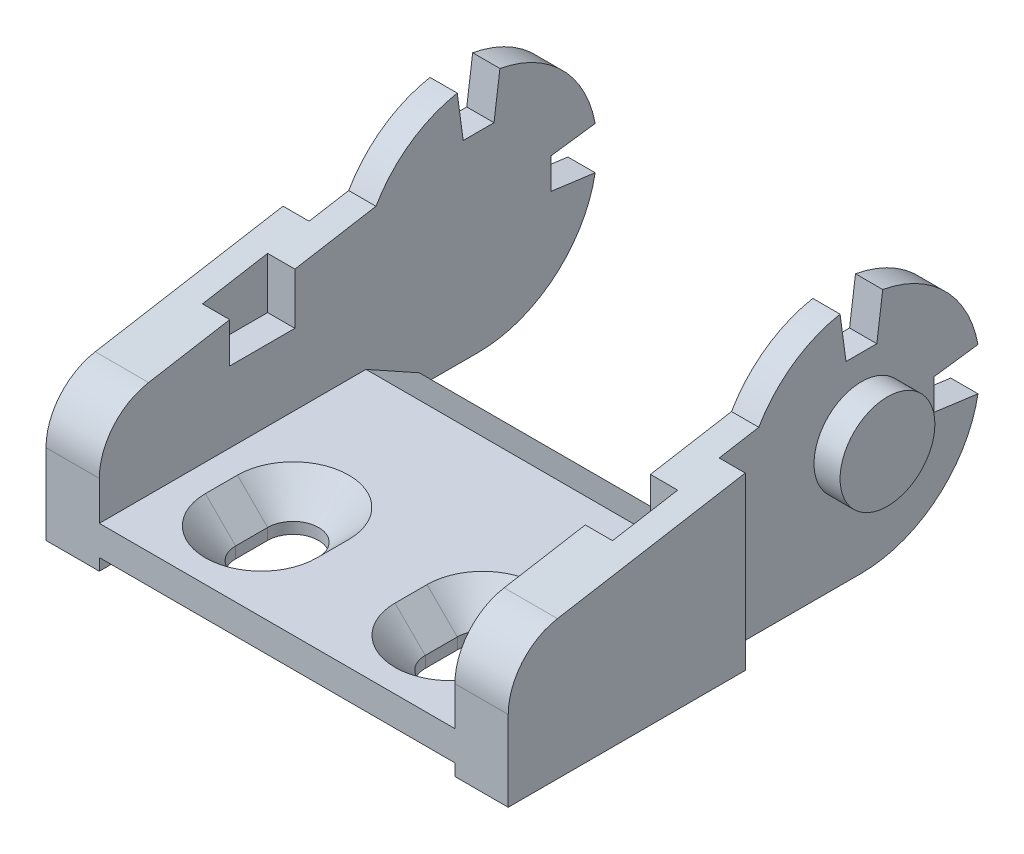
from build123d import *

# Parameters (mm, degrees)
BODY_DEPTH                                       = 32
BODY_DEPTH_BACK                                  = 15
PIVOT_START                                      = 15
PIVOT_PIN_R_SKETCH_R                             = 4
PIVOT_PIN_R_DEPTH                                = 4.25
OUTSIDE_SHAPE_CUT_OUT_DEPTH                      = 40.272286666
OUTSIDE_SHAPE_CUT_OUT_DEPTH_BACK                 = 40.272286666
OUTSIDE_SHAPE_CUT_OUT_SKETCH_W                   = 49
OUTSIDE_SHAPE_CUT_OUT_SKETCH_H                   = 22
OUTSIDE_START                                    = 17.3
OUTSIDE_SHAPE_CUT_OUT_SKETCH_R_W                 = 24
OUTSIDE_SHAPE_CUT_OUT_SKETCH_R_H                 = 24
OUTSIDE_SHAPE_CUT_OUT_SKETCH_R_R                 = 4
OUTSIDE_SHAPE_CUT_OUT_R_DEPTH                    = 22.923727913
INSIDE_START                                     = 15
INSIDE_SHAPE_CUT_OUT_DEPTH                       = 30
LIGHTENING_START                                 = 1.25
LIGHTENING_2_SKETCH_W                            = 34.6
LIGHTENING_2_SKETCH_H                            = 5.5
LIGHTENING_2_DEPTH                               = 38.973727913
F_2_START                                        = -8.25
F_2_LATERAL_SLOTS_ORIENTATED_LONGITUDINALL_DEPTH = 3.5


with BuildPart() as part:
    # Profile Sketch → Body (new, two sides: drawn at the far end of the back side and taken through both)
    with BuildSketch(Plane.XY.offset(-BODY_DEPTH_BACK)):
        Polygon((-19.5, -8.25), (19.5, -8.25), (19.5, 11.75), (15, 11.75), (15, -4.75), (-15, -4.75), (-15, 11.75), (-19.5, 11.75), align=None)
    extrude(amount=BODY_DEPTH + BODY_DEPTH_BACK)

    # Pivot Pin R Sketch → Pivot Pin R (add)
    with BuildSketch(Plane(origin=(0, 0, 0), x_dir=(0, 0, -1), z_dir=(1, 0, 0)).offset(PIVOT_START)):
        with Locations((0, 1.75)):
            Circle(PIVOT_PIN_R_SKETCH_R)
    pivot_pin_r = extrude(amount=PIVOT_PIN_R_DEPTH)

    # Pivot Pin L: Pivot Pin R across plane
    add(pivot_pin_r.mirror(Plane(origin=(0, 0, 0), x_dir=(0, 0, 1), z_dir=(1, 0, 0))))

    # Outside Shape Cut Out Sketch → Outside Shape Cut Out (cut, two sides: drawn at the far end of the back side and taken through both)
    with BuildSketch(Plane(origin=(0, 0, 0), x_dir=(0, 0, -1), z_dir=(1, 0, 0)).offset(-OUTSIDE_SHAPE_CUT_OUT_DEPTH_BACK)):
        with Locations((-9.5, 0.75)):
            Rectangle(OUTSIDE_SHAPE_CUT_OUT_SKETCH_W, OUTSIDE_SHAPE_CUT_OUT_SKETCH_H)
        with BuildLine():
            Line((-27.844593584, 3.462159665), (-8.660254038, 6.75))
            ThreePointArc((-8.660254038, 6.75), (-5.762166553, 9.922969878), (-1.8, 11.586666102))
            Line((-1.8, 11.586666102), (-1.3, 7.87535696))
            Line((-1.3, 7.87535696), (1.3, 7.87535696))
            Line((1.3, 7.87535696), (1.8, 11.586666102))
            ThreePointArc((1.8, 11.586666102), (7.071067812, 8.821067812), (9.836666102, 3.55))
            Line((9.836666102, 3.55), (6.12535696, 3.05))
            Line((6.12535696, 3.05), (6.12535696, 0.45))
            Line((6.12535696, 0.45), (9.836666102, -0.05))
            ThreePointArc((9.836666102, -0.05), (6.403124237, -5.931145748), (0, -8.25))
            Line((0, -8.25), (-32, -8.25))
            Line((-32, -8.25), (-32, -1.46599026))
            ThreePointArc((-32, -1.46599026), (-30.822497084, 1.757131835), (-27.844593584, 3.462159665))
        make_face(mode=Mode.SUBTRACT)
    extrude(amount=OUTSIDE_SHAPE_CUT_OUT_DEPTH + OUTSIDE_SHAPE_CUT_OUT_DEPTH_BACK, mode=Mode.SUBTRACT)

    # Outside Shape Cut Out Sketch R → Outside Shape Cut Out R (cut, through all)
    with BuildSketch(Plane(origin=(0, 0, 0), x_dir=(0, 0, -1), z_dir=(1, 0, 0)).offset(OUTSIDE_START)):
        with Locations((0, 1.75)):
            Rectangle(OUTSIDE_SHAPE_CUT_OUT_SKETCH_R_W, OUTSIDE_SHAPE_CUT_OUT_SKETCH_R_H)
        with Locations((0, 1.75)):
            Circle(OUTSIDE_SHAPE_CUT_OUT_SKETCH_R_R, mode=Mode.SUBTRACT)
    outside_shape_cut_out_r = extrude(amount=OUTSIDE_SHAPE_CUT_OUT_R_DEPTH, mode=Mode.SUBTRACT)

    # Outside Shape Cut Out L: Outside Shape Cut Out R across plane
    add(outside_shape_cut_out_r.mirror(Plane(origin=(0, 0, 0), x_dir=(0, 0, 1), z_dir=(1, 0, 0))), mode=Mode.SUBTRACT)

    # Inside Shape Cut Out Sketch → Inside Shape Cut Out (cut)
    with BuildSketch(Plane(origin=(0, 0, 0), x_dir=(0, 0, -1), z_dir=(1, 0, 0)).offset(INSIDE_START)):
        Polygon((-29, -6.25), (-29, -8.25), (-32, -8.25), (-32, -7.25), (-30.5, -7.25), (-30.5, -6.25), align=None)
        Polygon((-9.5, -4.75), (-5, -7.25), (-5, -8.25), (7.599342077, -8.25), (7.599342077, -4.75), align=None)
    extrude(amount=-INSIDE_SHAPE_CUT_OUT_DEPTH, mode=Mode.SUBTRACT)

    # Lightening 2 Sketch → Lightening 2 (cut, through all)
    with BuildSketch(Plane(origin=(0, 0, 0), x_dir=(1, 0, 0), z_dir=(0, 1, 0)).offset(LIGHTENING_START)):
        with Locations((0, -18.25)):
            Rectangle(LIGHTENING_2_SKETCH_W, LIGHTENING_2_SKETCH_H)
    extrude(amount=LIGHTENING_2_DEPTH, mode=Mode.SUBTRACT)

    # 2 Lateral Slots Orientated Longitudinall: read off the stored shape, not the designer's step
    # 2 Lateral Slots Orientated Longitudi 2 → 2 Lateral Slots Orientated Longitudinall (cut)
    with BuildSketch(Plane(origin=(0, 0, 0), x_dir=(1, 0, 0), z_dir=(0, 1, 0)).offset(F_2_START)):
        with BuildLine():
            Line((5.85, -22.65), (5.85, -25.35))
            ThreePointArc((5.85, -25.35), (8, -27.5), (10.15, -25.35))
            Line((10.15, -25.35), (10.15, -22.65))
            ThreePointArc((10.15, -22.65), (8, -20.5), (5.85, -22.65))
        make_face()
        with BuildLine():
            Line((-10.15, -22.65), (-10.15, -25.35))
            ThreePointArc((-10.15, -25.35), (-8, -27.5), (-5.85, -25.35))
            Line((-5.85, -25.35), (-5.85, -22.65))
            ThreePointArc((-5.85, -22.65), (-8, -20.5), (-10.15, -22.65))
        make_face()
    extrude(amount=F_2_LATERAL_SLOTS_ORIENTATED_LONGITUDINALL_DEPTH, mode=Mode.SUBTRACT)

    # 2 Lateral Slots Orientated Longitudi 3: loft between two sections, ruled curve by curve
    f_2_lateral_slots_orientated_longitudi_3_from = [
        Edge.make_three_point_arc((5.85, -7.3, 25.35), (6.47972042, -7.3, 26.87027958), (8, -7.3, 27.5)),
        Edge.make_three_point_arc((8, -7.3, 27.5), (9.52027958, -7.3, 26.87027958), (10.15, -7.3, 25.35)),
        Edge.make_three_point_arc((10.15, -7.3, 22.65), (9.52027958, -7.3, 21.12972042), (8, -7.3, 20.5)),
        Edge.make_three_point_arc((8, -7.3, 20.5), (6.47972042, -7.3, 21.12972042), (5.85, -7.3, 22.65)),
        Edge.make_line((10.15, -7.3, 25.35), (10.15, -7.3, 22.65)),
        Edge.make_line((5.85, -7.3, 25.35), (5.85, -7.3, 22.65)),
    ]
    f_2_lateral_slots_orientated_longitudi_3_to = [
        Edge.make_three_point_arc((3.3, -4.75, 25.35), (4.676598128, -4.75, 28.673401872), (8, -4.75, 30.05)),
        Edge.make_three_point_arc((8, -4.75, 30.05), (11.323401872, -4.75, 28.673401872), (12.7, -4.75, 25.35)),
        Edge.make_three_point_arc((12.7, -4.75, 22.65), (11.323401872, -4.75, 19.326598128), (8, -4.75, 17.95)),
        Edge.make_three_point_arc((8, -4.75, 17.95), (4.676598128, -4.75, 19.326598128), (3.3, -4.75, 22.65)),
        Edge.make_line((12.7, -4.75, 25.35), (12.7, -4.75, 22.65)),
        Edge.make_line((3.3, -4.75, 25.35), (3.3, -4.75, 22.65)),
    ]
    f_2_lateral_slots_orientated_longitudi_3 = Solid(Shell([*[Face.make_surface_from_curves(f_2_lateral_slots_orientated_longitudi_3_from[k], f_2_lateral_slots_orientated_longitudi_3_to[k]) for k in range(6)], Face(Wire(f_2_lateral_slots_orientated_longitudi_3_from)), Face(Wire(f_2_lateral_slots_orientated_longitudi_3_to))]))
    add(f_2_lateral_slots_orientated_longitudi_3, mode=Mode.SUBTRACT)

    # 2 Lateral Slots Orientated Longitudi 4: loft between two sections, ruled curve by curve
    f_2_lateral_slots_orientated_longitudi_4_from = [
        Edge.make_three_point_arc((-10.15, -7.3, 25.35), (-9.52027958, -7.3, 26.87027958), (-8, -7.3, 27.5)),
        Edge.make_three_point_arc((-8, -7.3, 27.5), (-6.47972042, -7.3, 26.87027958), (-5.85, -7.3, 25.35)),
        Edge.make_three_point_arc((-5.85, -7.3, 22.65), (-6.47972042, -7.3, 21.12972042), (-8, -7.3, 20.5)),
        Edge.make_three_point_arc((-8, -7.3, 20.5), (-9.52027958, -7.3, 21.12972042), (-10.15, -7.3, 22.65)),
        Edge.make_line((-5.85, -7.3, 25.35), (-5.85, -7.3, 22.65)),
        Edge.make_line((-10.15, -7.3, 25.35), (-10.15, -7.3, 22.65)),
    ]
    f_2_lateral_slots_orientated_longitudi_4_to = [
        Edge.make_three_point_arc((-12.7, -4.75, 25.35), (-11.323401872, -4.75, 28.673401872), (-8, -4.75, 30.05)),
        Edge.make_three_point_arc((-8, -4.75, 30.05), (-4.676598128, -4.75, 28.673401872), (-3.3, -4.75, 25.35)),
        Edge.make_three_point_arc((-3.3, -4.75, 22.65), (-4.676598128, -4.75, 19.326598128), (-8, -4.75, 17.95)),
        Edge.make_three_point_arc((-8, -4.75, 17.95), (-11.323401872, -4.75, 19.326598128), (-12.7, -4.75, 22.65)),
        Edge.make_line((-3.3, -4.75, 25.35), (-3.3, -4.75, 22.65)),
        Edge.make_line((-12.7, -4.75, 25.35), (-12.7, -4.75, 22.65)),
    ]
    f_2_lateral_slots_orientated_longitudi_4 = Solid(Shell([*[Face.make_surface_from_curves(f_2_lateral_slots_orientated_longitudi_4_from[k], f_2_lateral_slots_orientated_longitudi_4_to[k]) for k in range(6)], Face(Wire(f_2_lateral_slots_orientated_longitudi_4_from)), Face(Wire(f_2_lateral_slots_orientated_longitudi_4_to))]))
    add(f_2_lateral_slots_orientated_longitudi_4, mode=Mode.SUBTRACT)


solid = part.part
